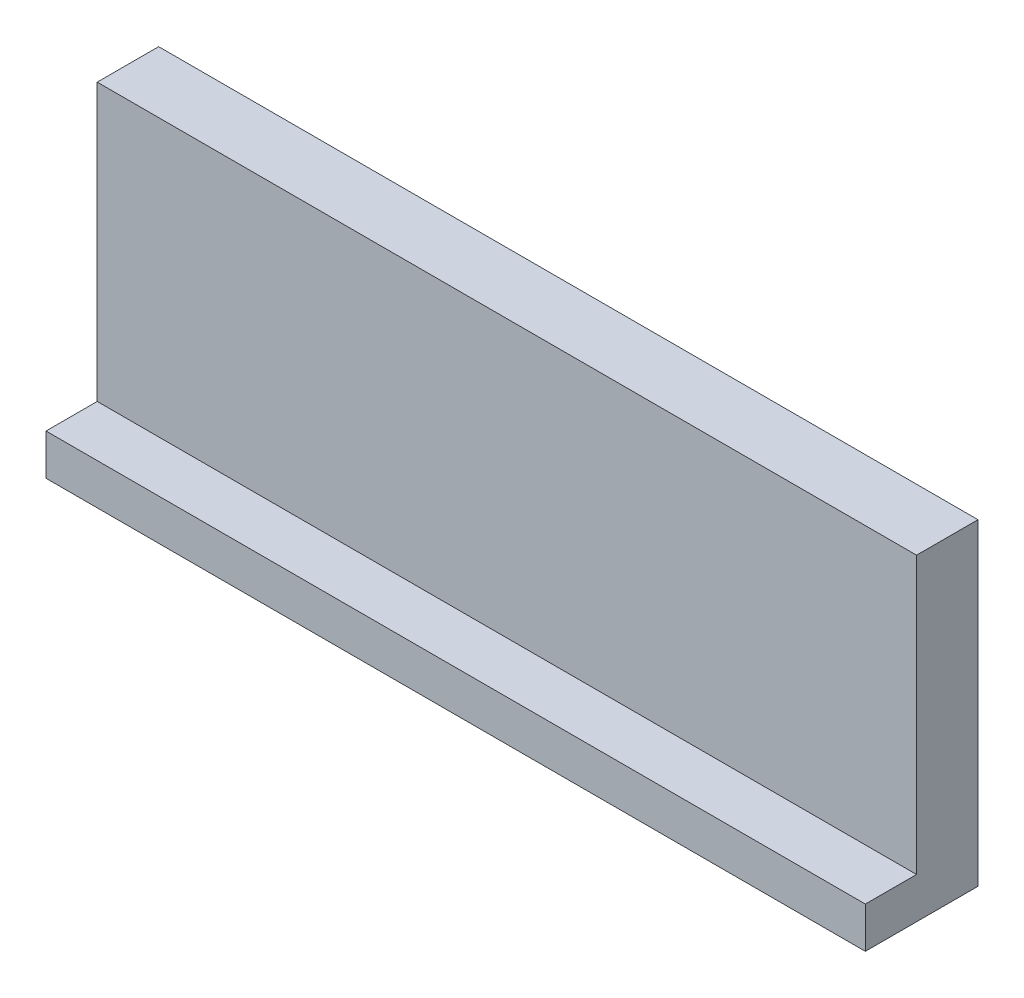
from build123d import *

# Parameters (mm, degrees)
CROQUIS1_W              = 80
CROQUIS1_H              = 31
SALIENTE_EXTRUIR1_DEPTH = 6
CROQUIS2_W              = 80
CROQUIS2_H              = 4
SALIENTE_EXTRUIR2_DEPTH = 5


with BuildPart() as part:
    # Croquis1 → Saliente-Extruir1 (new body)
    with BuildSketch(Plane.XY):
        with Locations((40, 15.5)):
            Rectangle(CROQUIS1_W, CROQUIS1_H)
    extrude(amount=SALIENTE_EXTRUIR1_DEPTH)

    # Croquis2 → Saliente-Extruir2 (add)
    with BuildSketch(Plane.XY.offset(6)):
        with Locations((40, 2)):
            Rectangle(CROQUIS2_W, CROQUIS2_H)
    extrude(amount=SALIENTE_EXTRUIR2_DEPTH)


solid = part.part
